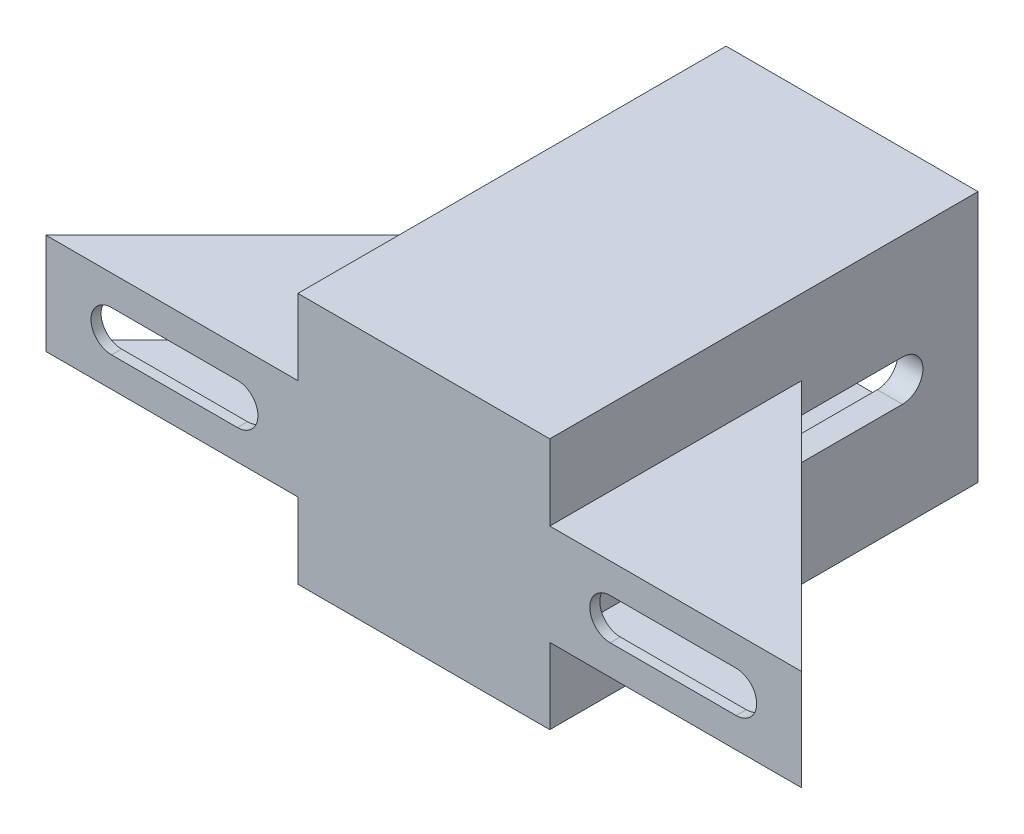
from build123d import *

# Parameters (mm, degrees)
BOSS_EXTRU_1_DEPTH      = 5
BOSS_EXTRU_1_DEPTH_BACK = 80
ESQUISSE1_W             = 50
ESQUISSE1_H             = 50
BOSS_EXTRU_2_DEPTH      = 50
ENL_V_MAT_EXTRU_2_DEPTH = 133.759180474
COQUE1_START            = -12.344146878
COQUE1_OUTLINE_W        = 40
COQUE1_OUTLINE_H        = 80
COQUE1_DEPTH            = 40
ENL_V_MAT_EXTRU_5_DEPTH = 134.997778874
ENL_V_MAT_EXTRU_6_DEPTH = 10
ENL_V_MAT_EXTRU_7_DEPTH = 134.68023318


# Read off the part's stored shape, not the designer's step: Coque1
with BuildPart() as part:
    # Esquisse1 → Boss.-Extru.1 (new, two sides: drawn at the far end of the back side and taken through both)
    with BuildSketch(Plane.XY.offset(-BOSS_EXTRU_1_DEPTH_BACK)):
        with Locations((25, 7.655853122)):
            Rectangle(ESQUISSE1_W, ESQUISSE1_H)
    extrude(amount=BOSS_EXTRU_1_DEPTH + BOSS_EXTRU_1_DEPTH_BACK)

    # Esquisse2 → Boss.-Extru.2 (add)
    with BuildSketch(Plane(origin=(50, 0, 0), x_dir=(0, 0, -1), z_dir=(1, 0, 0))):
        Polygon((-5, 17.655853122), (45, 17.655853122), (45, -2.344146878), (-5, -2.344146878), (-5, 7.655853122), align=None)
    boss_extru_2 = extrude(amount=BOSS_EXTRU_2_DEPTH)

    # Esquisse5 → Enlèv. mat.-Extru.2 (cut, through all)
    with BuildSketch(Plane.XZ.offset(2.344146878)):
        Polygon((50, -45), (100, 5), (100, -45), align=None)
    enl_v_mat_extru_2 = extrude(amount=-ENL_V_MAT_EXTRU_2_DEPTH, mode=Mode.SUBTRACT)

    # Symétrie2: Boss.-Extru.2, Enlèv. mat.-Extru.2 across plane
    add(boss_extru_2.mirror(Plane.ZY.offset(-25)))
    add(enl_v_mat_extru_2.mirror(Plane.ZY.offset(-25)), mode=Mode.SUBTRACT)

    # Coque1 outline → Coque1 (cut)
    with BuildSketch(Plane(origin=(0, 0, 0), x_dir=(1, 0, 0), z_dir=(0, 1, 0)).offset(COQUE1_START)):
        with Locations((25, 40)):
            Rectangle(COQUE1_OUTLINE_W, COQUE1_OUTLINE_H)
    extrude(amount=COQUE1_DEPTH, mode=Mode.SUBTRACT)

    # Esquisse16 → Enlèv. mat.-Extru.5 (cut, through all)
    with BuildSketch(Plane.XY.offset(3)):
        Polygon((52, 15.655853122), (98, 15.655853122), (98, 7.655853122), (98, -0.344146878), (52, -0.344146878), align=None)
    enl_v_mat_extru_5 = extrude(amount=-ENL_V_MAT_EXTRU_5_DEPTH, mode=Mode.SUBTRACT)

    # Symétrie8: Enlèv. mat.-Extru.5 across plane
    add(enl_v_mat_extru_5.mirror(Plane.ZY.offset(-25)), mode=Mode.SUBTRACT)

    # Esquisse17 → Enlèv. mat.-Extru.6 (cut)
    with BuildSketch(Plane(origin=(0, 0, 3), x_dir=(-1, 0, 0), z_dir=(0, 0, -1))):
        with BuildLine():
            Line((12, 11.720853122), (37, 11.720853122))
            ThreePointArc((37, 11.720853122), (41.065, 7.655853122), (37, 3.590853122))
            Line((37, 3.590853122), (12, 3.590853122))
            ThreePointArc((12, 3.590853122), (7.935, 7.655853122), (12, 11.720853122))
        make_face()
    enl_v_mat_extru_6 = extrude(amount=-ENL_V_MAT_EXTRU_6_DEPTH, mode=Mode.SUBTRACT)

    # Symétrie9: Enlèv. mat.-Extru.6 across plane
    add(enl_v_mat_extru_6.mirror(Plane.ZY.offset(-25)), mode=Mode.SUBTRACT)

    # Esquisse18 → Enlèv. mat.-Extru.7 (cut, through all)
    with BuildSketch(Plane.ZY.offset(2)):
        with BuildLine():
            Line((-65, 11.720853122), (-5, 11.720853122))
            ThreePointArc((-5, 11.720853122), (-0.935, 7.655853122), (-5, 3.590853122))
            Line((-5, 3.590853122), (-65, 3.590853122))
            ThreePointArc((-65, 3.590853122), (-69.065, 7.655853122), (-65, 11.720853122))
        make_face()
    extrude(amount=-ENL_V_MAT_EXTRU_7_DEPTH, mode=Mode.SUBTRACT)


solid = part.part
